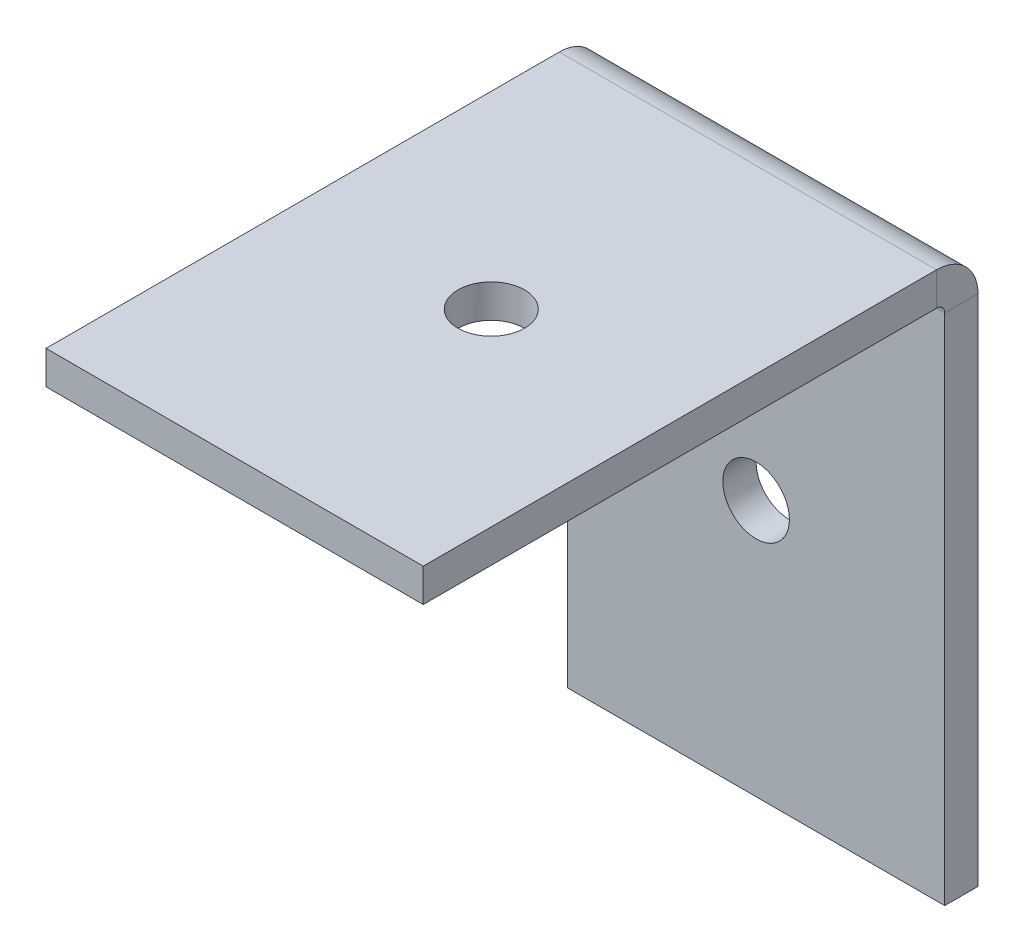
from build123d import *

# Parameters (mm, degrees)
SKETCH1_W                    = 34
SKETCH1_H                    = 3
BASE_FLANGE1_DEPTH           = 50
EDGE_FLANGE1_STRIP_W         = 13.4732
EDGE_FLANGE1_STRIP_H         = 3
EDGE_FLANGE1_STRIP_CUT_DEPTH = 34
EDGE_FLANGE1_DEPTH           = 34
SKETCH9_R                    = 3
CUT_EXTRUDE1_DEPTH           = 10
SKETCH10_R                   = 3
CUT_EXTRUDE2_DEPTH           = 10


# Sheet-metal steps are written as plain solids
with BuildPart() as part:
    # Sketch1 → Base-Flange1 (new body)
    with BuildSketch(Plane(origin=(0, 0, 0), x_dir=(1, 0, 0), z_dir=(0, 1, 0))):
        with Locations((17, -1.5)):
            Rectangle(SKETCH1_W, SKETCH1_H)
    extrude(amount=BASE_FLANGE1_DEPTH)

    # Edge-Flange1 strip (across the edge) → Edge-Flange1 strip cut (cut)
    with BuildSketch(Plane(origin=(34, 50, 3), x_dir=(0, -1, 0), z_dir=(-1, 0, 0))):
        with Locations((-3, -1.5)):
            Rectangle(EDGE_FLANGE1_STRIP_W, EDGE_FLANGE1_STRIP_H)
    extrude(amount=EDGE_FLANGE1_STRIP_CUT_DEPTH, mode=Mode.SUBTRACT)

    # Edge-Flange1 section (across the edge) → Edge-Flange1 (add)
    with BuildSketch(Plane(origin=(34, 50, 3), x_dir=(0, -1, 0), z_dir=(-1, 0, 0))):
        with BuildLine():
            Line((0, 0.7366), (0, 47))
            Line((0, 47), (3, 47))
            Line((3, 47), (3, 0.7366))
            ThreePointArc((3, 0.7366), (3.215745145, 0.215745145), (3.7366, 0))
            Line((3.7366, 0), (3.7366, -3))
            ThreePointArc((3.7366, -3), (1.094424801, -1.905575199), (0, 0.7366))
        make_face()
    extrude(amount=EDGE_FLANGE1_DEPTH)

    # Sketch9 → Cut-Extrude1 (cut)
    with BuildSketch(Plane(origin=(0, 50, 0), x_dir=(1, 0, 0), z_dir=(0, 1, 0))):
        with Locations(Location((17, -26.8683, 0), (0, 0, 270))):
            Circle(SKETCH9_R)
    extrude(amount=-CUT_EXTRUDE1_DEPTH, mode=Mode.SUBTRACT)

    # Sketch10 → Cut-Extrude2 (cut)
    with BuildSketch(Plane.XY.offset(3)):
        with Locations((17, 23.1317)):
            Circle(SKETCH10_R)
    extrude(amount=-CUT_EXTRUDE2_DEPTH, mode=Mode.SUBTRACT)


solid = part.part
